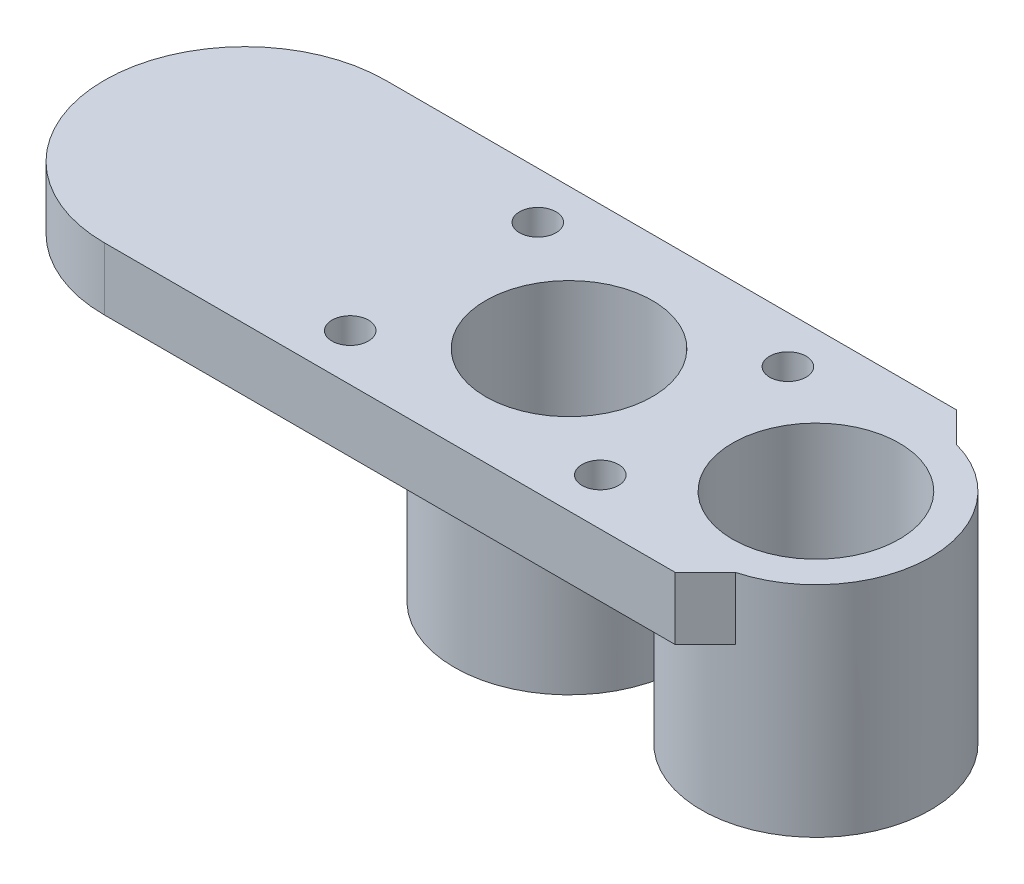
from build123d import *

# Parameters (mm, degrees)
SKETCH1_R               = 1.75
SKETCH1_R_2             = 5
BOSS_EXTRUDE1_DEPTH     = 6
SKETCH2_R               = 3
SKETCH2_R_2             = 1.75
CUT_EXTRUDE1_DEPTH      = 3
CUT_EXTRUDE2_START      = -3
SKETCH3_R               = 8
SKETCH3_R_2             = 5
CUT_EXTRUDE2_DEPTH      = 3
SKETCH5_R               = 13.5
BOSS_EXTRUDE2_DEPTH     = 6
CUT_EXTRUDE3_DEPTH      = 47.983082062
CUT_EXTRUDE3_DEPTH_BACK = 47.983082062
SKETCH6_R               = 8
BOSS_EXTRUDE6_START     = -12
SKETCH9_R               = 11
SKETCH9_R_2             = 8
BOSS_EXTRUDE6_DEPTH     = 12
BOSS_EXTRUDE7_START     = 3
SKETCH10_R              = 11
SKETCH10_R_2            = 5
BOSS_EXTRUDE7_DEPTH     = 3
CHAMFER3_SIZE           = 2.5


with BuildPart() as part:
    # Sketch1 → Boss-Extrude1 (new body)
    with BuildSketch(Plane(origin=(0, 0, 0), x_dir=(1, 0, 0), z_dir=(0, 1, 0))):
        with BuildLine():
            Line((23.69, 13.5), (-31.1, 13.5))
            Line((-31.1, 13.5), (-31.1, 10.5))
            ThreePointArc((-31.1, 10.5), (-20.6, 0), (-31.1, -10.5))
            Line((-31.1, -10.5), (-31.1, -13.5))
            Line((-31.1, -13.5), (23.69, -13.5))
            Line((23.69, -13.5), (23.69, -11))
            ThreePointArc((23.69, -11), (34.69, 0), (23.69, 11))
            Line((23.69, 11), (23.69, 13.5))
        make_face()
        with Locations(Location((-12, -9, 0), (0, 0, 270))):
            Circle(SKETCH1_R, mode=Mode.SUBTRACT)
        with Locations(Location((12, -9, 0), (0, 0, 270))):
            Circle(SKETCH1_R, mode=Mode.SUBTRACT)
        with Locations(Location((-12, 9, 0), (0, 0, 270))):
            Circle(SKETCH1_R, mode=Mode.SUBTRACT)
        with Locations(Location((0, 0, 0), (0, 0, 270))):
            Circle(SKETCH1_R_2, mode=Mode.SUBTRACT)
        with Locations(Location((12, 9, 0), (0, 0, 270))):
            Circle(SKETCH1_R, mode=Mode.SUBTRACT)
        with Locations(Location((23.69, 0, 0), (0, 0, 270))):
            Circle(SKETCH1_R_2, mode=Mode.SUBTRACT)
    extrude(amount=BOSS_EXTRUDE1_DEPTH)

    # Sketch2 → Cut-Extrude1 (cut)
    # profile 1 of 4: a face of its own
    with BuildSketch(Plane.XZ):
        with Locations(Location((-12, -9, 0), (0, 0, 270))):
            Circle(SKETCH2_R)
        with Locations(Location((-12, -9, 0), (0, 0, 270))):
            Circle(SKETCH2_R_2, mode=Mode.SUBTRACT)
    # profile 2 of 4: a face of its own
    with BuildSketch(Plane.XZ):
        with Locations(Location((-12, 9, 0), (0, 0, 270))):
            Circle(SKETCH2_R)
        with Locations(Location((-12, 9, 0), (0, 0, 270))):
            Circle(SKETCH2_R_2, mode=Mode.SUBTRACT)
    # profile 3 of 4: a face of its own
    with BuildSketch(Plane.XZ):
        with Locations(Location((12, 9, 0), (0, 0, 270))):
            Circle(SKETCH2_R)
        with Locations(Location((12, 9, 0), (0, 0, 270))):
            Circle(SKETCH2_R_2, mode=Mode.SUBTRACT)
    # profile 4 of 4: a face of its own
    with BuildSketch(Plane.XZ):
        with Locations(Location((12, -9, 0), (0, 0, 270))):
            Circle(SKETCH2_R)
        with Locations(Location((12, -9, 0), (0, 0, 270))):
            Circle(SKETCH2_R_2, mode=Mode.SUBTRACT)
    extrude(amount=-CUT_EXTRUDE1_DEPTH, mode=Mode.SUBTRACT)

    # Sketch3 → Cut-Extrude2 (cut)
    # profile 1 of 2: a face of its own
    with BuildSketch(Plane(origin=(0, 6, 0), x_dir=(1, 0, 0), z_dir=(0, 1, 0)).offset(CUT_EXTRUDE2_START)):
        with Locations(Location((0, 0, 0), (0, 0, 270))):
            Circle(SKETCH3_R)
        with Locations(Location((0, 0, 0), (0, 0, 270))):
            Circle(SKETCH3_R_2, mode=Mode.SUBTRACT)
    # profile 2 of 2: a face of its own
    with BuildSketch(Plane(origin=(0, 6, 0), x_dir=(1, 0, 0), z_dir=(0, 1, 0)).offset(CUT_EXTRUDE2_START)):
        with Locations(Location((23.69, 0, 0), (0, 0, 270))):
            Circle(SKETCH3_R)
        with Locations(Location((23.69, 0, 0), (0, 0, 270))):
            Circle(SKETCH3_R_2, mode=Mode.SUBTRACT)
    extrude(amount=CUT_EXTRUDE2_DEPTH, mode=Mode.SUBTRACT)

    # Sketch5 → Boss-Extrude2 (add)
    with BuildSketch(Plane(origin=(0, 0, 0), x_dir=(1, 0, 0), z_dir=(0, 1, 0))):
        with Locations((-31.1, 0)):
            Circle(SKETCH5_R)
    extrude(amount=BOSS_EXTRUDE2_DEPTH)

    # Sketch6 → Cut-Extrude3 (cut, two sides: drawn at the far end of the back side and taken through both)
    with BuildSketch(Plane(origin=(0, 6, 0), x_dir=(1, 0, 0), z_dir=(0, 1, 0)).offset(-CUT_EXTRUDE3_DEPTH_BACK)):
        with Locations(Location((0, 0, 0), (0, 0, 270))):
            Circle(SKETCH6_R)
        with Locations(Location((23.69, 0, 0), (0, 0, 270))):
            Circle(SKETCH6_R)
    extrude(amount=CUT_EXTRUDE3_DEPTH + CUT_EXTRUDE3_DEPTH_BACK, mode=Mode.SUBTRACT)

    # Sketch9 → Boss-Extrude6 (add)
    # profile 1 of 2: a face of its own
    with BuildSketch(Plane(origin=(0, 0, 0), x_dir=(1, 0, 0), z_dir=(0, 1, 0)).offset(BOSS_EXTRUDE6_START)):
        with Locations(Location((0, 0, 0), (0, 0, 270))):
            Circle(SKETCH9_R)
        with Locations(Location((0, 0, 0), (0, 0, 270))):
            Circle(SKETCH9_R_2, mode=Mode.SUBTRACT)
    # profile 2 of 2: a face of its own
    with BuildSketch(Plane(origin=(0, 0, 0), x_dir=(1, 0, 0), z_dir=(0, 1, 0)).offset(BOSS_EXTRUDE6_START)):
        with BuildLine():
            ThreePointArc((23.69, 11), (12.69, 0), (23.69, -11))
            ThreePointArc((23.69, -11), (31.468174593, -7.778174593), (34.69, 0))
            ThreePointArc((34.69, 0), (31.468174593, 7.778174593), (23.69, 11))
        make_face()
        with Locations(Location((23.69, 0, 0), (0, 0, 270))):
            Circle(SKETCH9_R_2, mode=Mode.SUBTRACT)
    extrude(amount=BOSS_EXTRUDE6_DEPTH)

    # Sketch10 → Boss-Extrude7 (add)
    # profile 1 of 2: a face of its own
    with BuildSketch(Plane.XZ.offset(12).offset(BOSS_EXTRUDE7_START)):
        with Locations(Location((23.69, 0, 0), (0, 0, 270))):
            Circle(SKETCH10_R)
        with Locations(Location((23.69, 0, 0), (0, 0, 270))):
            Circle(SKETCH10_R_2, mode=Mode.SUBTRACT)
    # profile 2 of 2: a face of its own
    with BuildSketch(Plane.XZ.offset(12).offset(BOSS_EXTRUDE7_START)):
        with Locations(Location((0, 0, 0), (0, 0, 90))):
            Circle(SKETCH10_R)
        with Locations(Location((0, 0, 0), (0, 0, 270))):
            Circle(SKETCH10_R_2, mode=Mode.SUBTRACT)
    extrude(amount=-BOSS_EXTRUDE7_DEPTH)

    # Chamfer3
    # the kernel refuses this chamfer: 2.5 mm, written as the material it adds along each edge
    with BuildSketch(Plane(origin=(23.69, 0, 11), x_dir=(0.9912092295509808, 0, -0.13230367815352337), z_dir=(0, 1, 0))) as chamfer3_piece_1_section:
        with BuildLine():
            Line((2.910680919, 0), (-CHAMFER3_SIZE * 0.132303678154, -CHAMFER3_SIZE * 0.991209229551))
            Line((-CHAMFER3_SIZE * 0.132303678154, -CHAMFER3_SIZE * 0.991209229551), (0, 0))
            ThreePointArc((0, 0), (1.49552658, -0.096625069), (2.910680919, 0))
        make_face()
    chamfer3_piece_1 = extrude(amount=6, mode=Mode.PRIVATE)
    chamfer3_piece_1 = split(chamfer3_piece_1, bisect_by=Plane(origin=(23.69, 0, 13.5), z_dir=(0, 0, -1)), keep=Keep.TOP, mode=Mode.PRIVATE)
    add(chamfer3_piece_1)
    with BuildSketch(Plane(origin=(23.69, 0, -11), x_dir=(0, 0, -1), z_dir=(0, 1, 0))) as chamfer3_piece_2_section:
        with BuildLine():
            Line((CHAMFER3_SIZE, 0), (-0.385093792, -2.885093792))
            ThreePointArc((-0.385093792, -2.885093792), (-0.102088007, -1.495163601), (0, 0))
            Line((0, 0), (CHAMFER3_SIZE, 0))
        make_face()
    chamfer3_piece_2 = extrude(amount=6, mode=Mode.PRIVATE)
    chamfer3_piece_2 = split(chamfer3_piece_2, bisect_by=Plane(origin=(23.69, 0, -13.5), z_dir=(0, 0, 1)), keep=Keep.TOP, mode=Mode.PRIVATE)
    add(chamfer3_piece_2)


solid = part.part
